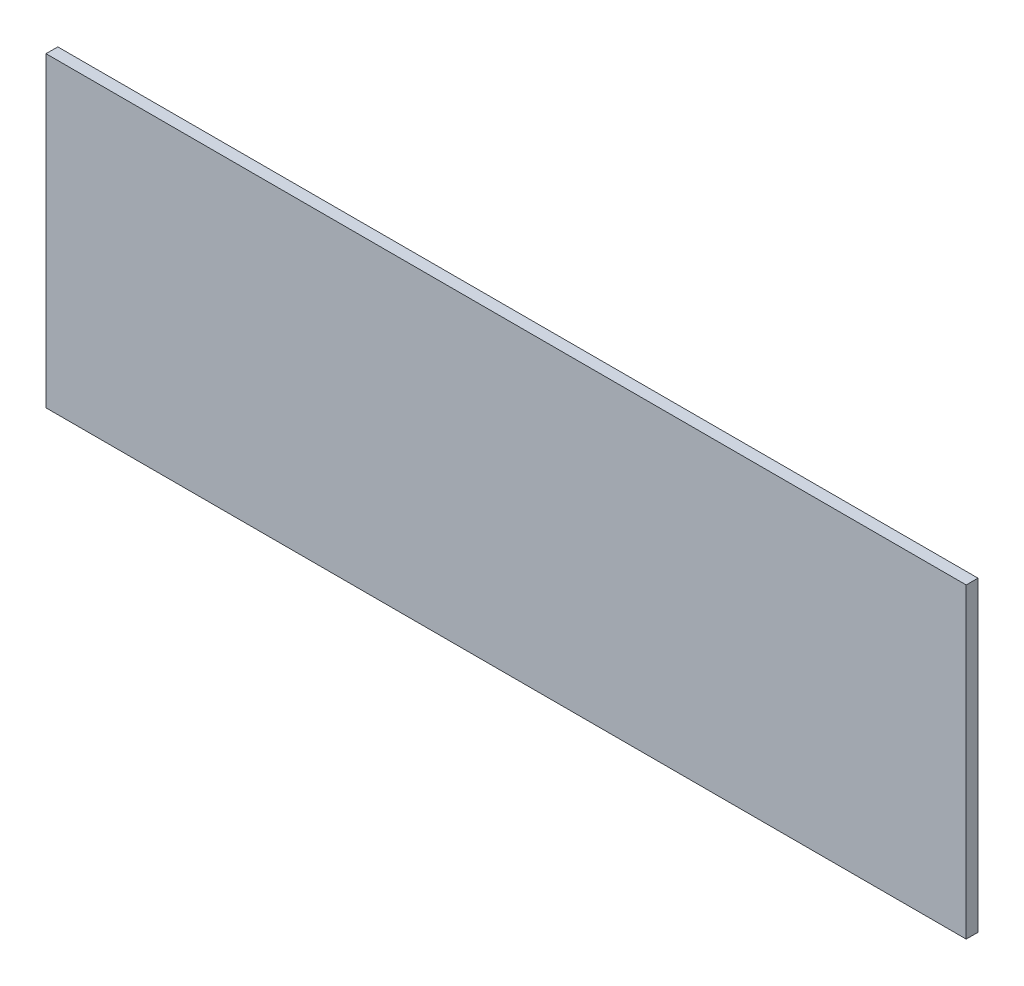
from build123d import *

# Parameters (mm, degrees)
SKETCH1_W           = 390
SKETCH1_H           = 130
BOSS_EXTRUDE1_DEPTH = 2.5


with BuildPart() as part:
    # Sketch1 → Boss-Extrude1 (new, symmetric)
    with BuildSketch(Plane.XY):
        Rectangle(SKETCH1_W, SKETCH1_H)
    extrude(amount=BOSS_EXTRUDE1_DEPTH, both=True)


solid = part.part
